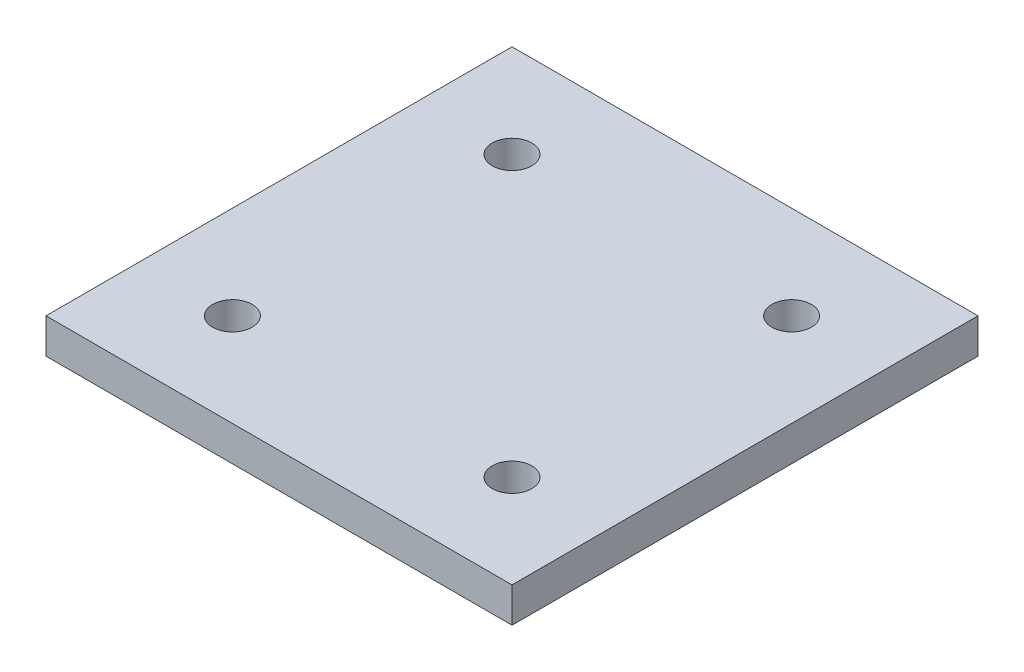
from build123d import *

# Parameters (mm, degrees)
SKETCH1_W             = 40
SKETCH1_H             = 40
CROSS_JOINER_DEPTH    = 3
BOLT_HOLES_DEPTH      = 29.442925307
BOLT_HOLES_DEPTH_BACK = 29.442925307
SKETCH2_R             = 1.7


with BuildPart() as part:
    # Sketch1 → Cross Joiner (new body)
    with BuildSketch(Plane(origin=(0, 0, 0), x_dir=(1, 0, 0), z_dir=(0, 1, 0))):
        Rectangle(SKETCH1_W, SKETCH1_H)
    extrude(amount=CROSS_JOINER_DEPTH)

    # Sketch2 → Bolt Holes (cut, two sides: drawn at the far end of the back side and taken through both)
    with BuildSketch(Plane(origin=(0, 0, 0), x_dir=(1, 0, 0), z_dir=(0, 1, 0)).offset(-BOLT_HOLES_DEPTH_BACK)):
        with Locations((-12, -12)):
            Circle(SKETCH2_R)
        with Locations((-12, 12)):
            Circle(SKETCH2_R)
        with Locations((12, -12)):
            Circle(SKETCH2_R)
        with Locations((12, 12)):
            Circle(SKETCH2_R)
    extrude(amount=BOLT_HOLES_DEPTH + BOLT_HOLES_DEPTH_BACK, mode=Mode.SUBTRACT)


solid = part.part
